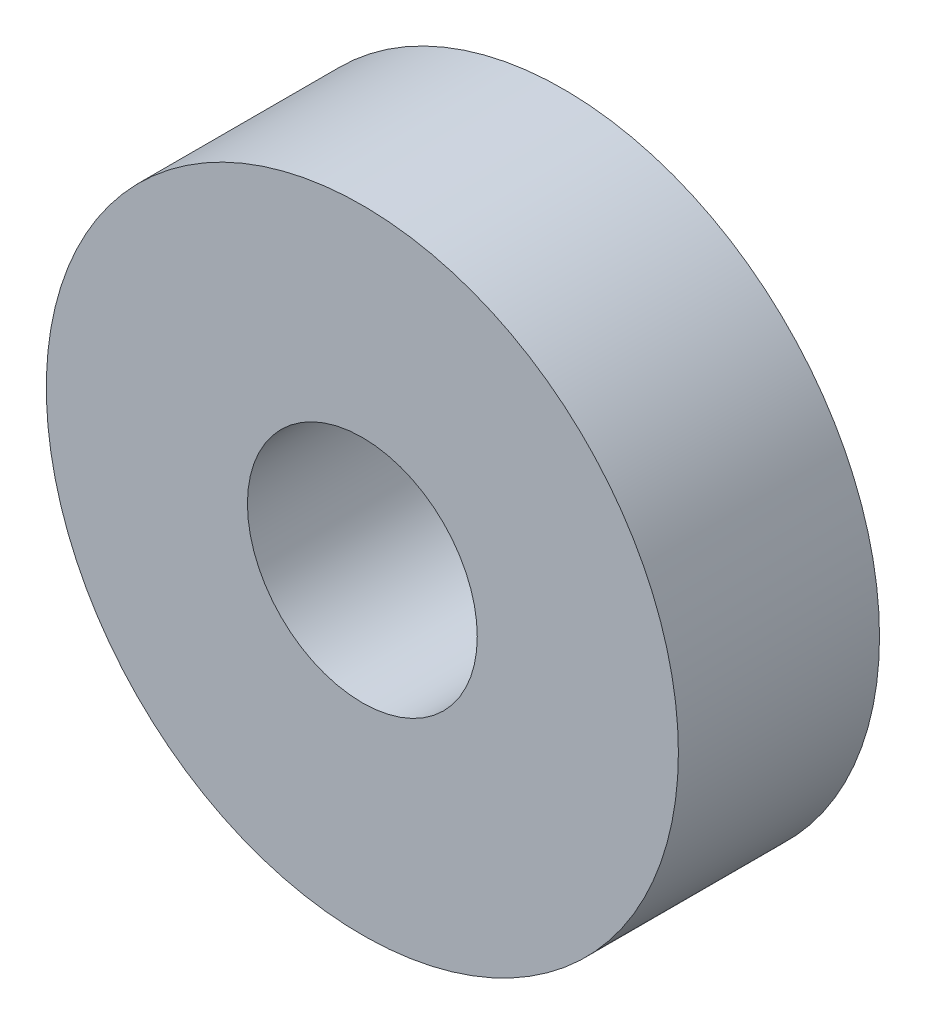
from build123d import *

# Parameters (mm, degrees)
SKETCH2_R           = 11
SKETCH2_R_2         = 4
BOSS_EXTRUDE1_DEPTH = 3.5


with BuildPart() as part:
    # Sketch2 → Boss-Extrude1 (new, symmetric)
    with BuildSketch(Plane.XY):
        Circle(SKETCH2_R)
        Circle(SKETCH2_R_2, mode=Mode.SUBTRACT)
    extrude(amount=BOSS_EXTRUDE1_DEPTH, both=True)


solid = part.part
